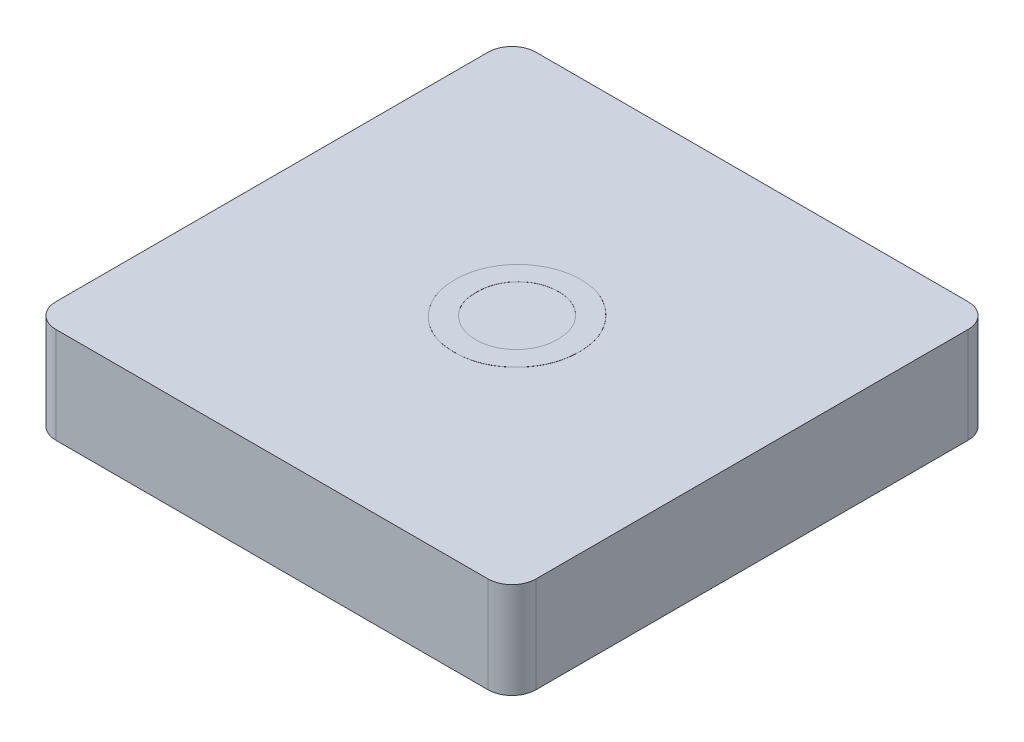
from build123d import *

# Parameters (mm, degrees)
SKETCH1_W           = 12.7
SKETCH1_H           = 12.7
BOSS_EXTRUDE1_DEPTH = 2.54
FILLET1_R           = 0.635
SHELL1_START        = 0.635
SHELL1_OUTLINE_W    = 1.905
SHELL1_OUTLINE_H    = 11.43
SHELL1_DEPTH        = 11.43
SKETCH2_R           = 2.54
BOSS_EXTRUDE2_DEPTH = 1.905
BOSS_EXTRUDE3_DEPTH = 0.00254


# Read off the part's stored shape, not the designer's step: Shell1
with BuildPart() as part:
    # Sketch1 → Boss-Extrude1 (new body)
    with BuildSketch(Plane(origin=(0, 0, 0), x_dir=(1, 0, 0), z_dir=(0, 1, 0))):
        with Locations((6.35, 6.35)):
            Rectangle(SKETCH1_W, SKETCH1_H)
    extrude(amount=BOSS_EXTRUDE1_DEPTH)

    # Fillet1
    fillet1_edges = [part.edges().sort_by_distance(p)[0] for p in [
        (0, 1.27, -12.7),
        (12.7, 1.27, -12.7),
        (12.7, 1.27, 0),
        (0, 1.27, 0),
    ]]
    fillet(fillet1_edges, radius=FILLET1_R)

    # Shell1 outline → Shell1 (cut)
    with BuildSketch(Plane.YZ.offset(SHELL1_START)):
        with Locations((0.9525, -6.35)):
            Rectangle(SHELL1_OUTLINE_W, SHELL1_OUTLINE_H)
    extrude(amount=SHELL1_DEPTH, mode=Mode.SUBTRACT)

    # Sketch2 → Boss-Extrude2 (add)
    with BuildSketch(Plane(origin=(0, 1.905, 0), x_dir=(-1, 0, 0), z_dir=(0, -1, 0))):
        with Locations(Location((-6.35, 6.35, 0), (0, 0, 270))):
            Circle(SKETCH2_R)
    extrude(amount=BOSS_EXTRUDE2_DEPTH)

    # Sketch3 → Boss-Extrude3 (add)
    with BuildSketch(Plane(origin=(0, 2.54, 0), x_dir=(1, 0, 0), z_dir=(0, 1, 0))):
        with BuildLine():
            add(Edge.make_bspline(
                [(6.43044351, 8.082410256), (6.485644776, 8.080980997), (6.594624578, 8.078159315), (6.75489454, 8.054638391), (6.909344283, 8.016314418), (7.057903964, 7.963041323), (7.200201607, 7.893376201), (7.336739144, 7.809294103), (7.467027503, 7.709208031), (7.589731594, 7.595452826), (7.703132304, 7.471749008), (7.801394086, 7.338559855), (7.885188128, 7.199336432), (7.954636855, 7.053705686), (8.007534987, 6.900659054), (8.044655794, 6.740976872), (8.068504074, 6.574704567), (8.071246993, 6.461495791), (8.072641026, 6.403959736)],
                knots=[0, 0, 0, 0, 1.014329547, 2.002516266, 2.970391464, 3.935626869, 4.897733899, 5.877609409, 6.878433252, 7.912639331, 8.949961323, 9.958554974, 10.949718813, 11.932905612, 12.9188844, 13.919928257, 14.942845884, 16, 16, 16, 16], degree=3))
            add(Edge.make_bspline(
                [(8.072641026, 6.403959736), (8.071156441, 6.347071978), (8.068231019, 6.234972828), (8.045629385, 6.070232788), (8.007883459, 5.912261135), (7.955882521, 5.760700295), (7.887693332, 5.616284378), (7.805533364, 5.478091308), (7.707234573, 5.347403549), (7.596382302, 5.224291235), (7.474343571, 5.112540392), (7.345085181, 5.014060155), (7.209203969, 4.930611718), (7.06689882, 4.862233306), (6.917864568, 4.809167338), (6.762469346, 4.771725442), (6.600722769, 4.748971246), (6.490727254, 4.746064933), (6.434895633, 4.744589744)],
                knots=[0, 0, 0, 0, 1.051557043, 2.072126891, 3.067553643, 4.050577992, 5.02905126, 6.015227836, 7.017913613, 8.04756643, 9.074058332, 10.072836633, 11.047628519, 12.017157415, 12.98668631, 13.966869689, 14.968021931, 16, 16, 16, 16], degree=3))
            add(Edge.make_bspline(
                [(6.434895633, 4.744589744), (6.376502452, 4.745913061), (6.261767834, 4.748513198), (6.093853207, 4.773239317), (5.932976485, 4.81048549), (5.780489125, 4.866073406), (5.634838175, 4.935562974), (5.497093773, 5.021143543), (5.367302212, 5.122673685), (5.246207998, 5.237553175), (5.136496346, 5.363256535), (5.039654293, 5.496050986), (4.957965873, 5.634922098), (4.891428098, 5.779934863), (4.838972388, 5.930188064), (4.801970845, 6.086596786), (4.780113151, 6.248785903), (4.777068501, 6.358947994), (4.775525641, 6.414772035)],
                knots=[0, 0, 0, 0, 1.067978421, 2.098431617, 3.099715153, 4.085208694, 5.062210972, 6.048429807, 7.046490867, 8.072918869, 9.098532598, 10.095778865, 11.076610158, 12.041847152, 13.011192615, 13.984257998, 14.978533688, 16, 16, 16, 16], degree=3))
            add(Edge.make_bspline(
                [(4.775525641, 6.414772035), (4.776009879, 6.452327528), (4.776972224, 6.526962974), (4.788564684, 6.637568896), (4.805254492, 6.746015938), (4.829937927, 6.851871722), (4.859921992, 6.95588301), (4.898770583, 7.057081639), (4.942990793, 7.156548689), (4.994657946, 7.253109331), (5.052106823, 7.345875124), (5.114788663, 7.434408477), (5.182861079, 7.517638892), (5.256104786, 7.596113325), (5.334772192, 7.669315958), (5.417828509, 7.738283076), (5.506884545, 7.801182667), (5.599991145, 7.859550865), (5.696623393, 7.912332215), (5.796387909, 7.95725812), (5.897229347, 7.996491149), (6.000494812, 8.027455589), (6.105077632, 8.052675803), (6.212095061, 8.069354362), (6.320580259, 8.0809465), (6.393735517, 8.08192118), (6.43044351, 8.082410256)],
                knots=[0, 0, 0, 0, 1.034744296, 2.056386356, 3.06226378, 4.057406941, 5.050368692, 6.043467995, 7.042652155, 8.049140477, 9.059438543, 10.048523776, 11.036952808, 12.020949711, 13.004946614, 13.997082645, 14.994316842, 16.007702937, 17.024872941, 18.026463647, 19.021641123, 20.005082605, 20.995858141, 21.984425357, 22.988620895, 24, 24, 24, 24], degree=3))
        make_face()
        with BuildLine():
            add(Edge.make_bspline(
                [(6.421539263, 7.512538462), (6.384388818, 7.511541632), (6.311068706, 7.509574288), (6.203521455, 7.494585794), (6.100272296, 7.470647465), (6.001893579, 7.435973087), (5.907958924, 7.391841405), (5.818301813, 7.33840662), (5.734163811, 7.27383197), (5.65442302, 7.201584181), (5.582390337, 7.121083541), (5.518747189, 7.034813414), (5.465488125, 6.942917871), (5.420883325, 6.846250599), (5.387305796, 6.7437246), (5.36338953, 6.636142972), (5.348275342, 6.523320346), (5.34637018, 6.446409308), (5.345397436, 6.407139824)],
                knots=[0, 0, 0, 0, 1.033739768, 2.040188636, 3.016340934, 3.979330865, 4.937572243, 5.900995986, 6.878200029, 7.884839167, 8.891893314, 9.879764717, 10.863503415, 11.843163062, 12.837761627, 13.859916423, 14.907309254, 16, 16, 16, 16], degree=3))
            add(Edge.make_bspline(
                [(5.345397436, 6.407139824), (5.346687146, 6.363620401), (5.349214763, 6.278329544), (5.366999387, 6.15390954), (5.397427109, 6.036407195), (5.441364147, 5.926397195), (5.495857601, 5.822657962), (5.563529822, 5.726460967), (5.643284842, 5.637230227), (5.704727462, 5.585133605), (5.73591226, 5.558692308)],
                knots=[0, 0, 0, 0, 1.078454662, 2.113592447, 3.107694534, 4.079536787, 5.043276885, 6.005368276, 6.987637804, 8, 8, 8, 8], degree=3))
            add(Edge.make_bspline(
                [(5.73591226, 5.558692308), (5.761458562, 5.539158493), (5.811975605, 5.500530963), (5.892611804, 5.451021859), (5.97565121, 5.408587618), (6.061720462, 5.374301253), (6.150637783, 5.347332175), (6.242390982, 5.328446173), (6.336850052, 5.316593574), (6.400727701, 5.315176964), (6.43298758, 5.314461538)],
                knots=[0, 0, 0, 0, 1.023928204, 2.024787132, 3.009472467, 3.9914905, 4.972207045, 5.96565515, 6.972602802, 8, 8, 8, 8], degree=3))
            add(Edge.make_bspline(
                [(6.43298758, 5.314461538), (6.469499222, 5.31546682), (6.541337026, 5.317444744), (6.646882227, 5.332248722), (6.747997736, 5.357302397), (6.845311285, 5.391672599), (6.938542266, 5.436358393), (7.027235034, 5.491450558), (7.111545092, 5.556272633), (7.191184294, 5.629469193), (7.263978289, 5.71028695), (7.327488627, 5.797017233), (7.382441064, 5.887749113), (7.426118306, 5.983766763), (7.461022406, 6.084163822), (7.484650828, 6.189384925), (7.499892697, 6.298996313), (7.501798396, 6.373590736), (7.502769231, 6.411591947)],
                knots=[0, 0, 0, 0, 1.026359118, 2.019393844, 2.989460624, 3.950973911, 4.916101784, 5.890408035, 6.881132271, 7.902007068, 8.92769091, 9.933912415, 10.920395702, 11.90457117, 12.894218921, 13.903490204, 14.931958862, 16, 16, 16, 16], degree=3))
            add(Edge.make_bspline(
                [(7.502769231, 6.411591947), (7.501764805, 6.449374641), (7.499787746, 6.523744112), (7.484957712, 6.633073689), (7.46006292, 6.737830273), (7.425589509, 6.838184941), (7.381568787, 6.934236078), (7.3271327, 7.025645912), (7.262472255, 7.112326071), (7.18907561, 7.193685865), (7.109187873, 7.268450303), (7.023420404, 7.333332245), (6.934173075, 7.38971259), (6.839398116, 7.433878675), (6.741034542, 7.469065702), (6.638482136, 7.494977933), (6.531352472, 7.509468994), (6.458469947, 7.511506185), (6.421539263, 7.512538462)],
                knots=[0, 0, 0, 0, 1.055025985, 2.07665775, 3.074803781, 4.057872707, 5.035505728, 6.020516407, 7.023567878, 8.050795229, 9.077271434, 10.074415901, 11.050397877, 12.019801805, 12.988065821, 13.964604439, 14.968634123, 16, 16, 16, 16], degree=3))
        make_face(mode=Mode.SUBTRACT)
    extrude(amount=BOSS_EXTRUDE3_DEPTH)


solid = part.part
